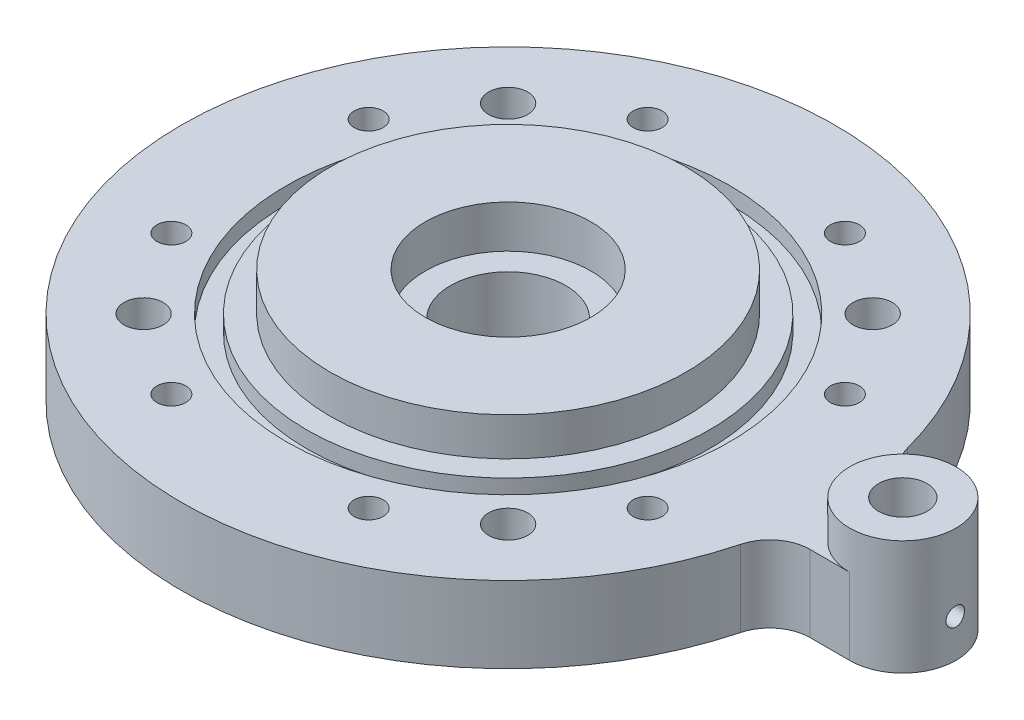
from build123d import *

# Parameters (mm, degrees)
BASE_DEPTH                       = 13.175
SKETCH3_R                        = 3.373437
SKETCH3_R_2                      = 3.373438
SQUARE_BOLT_HOLES_DEPTH          = 97.509984
SKETCH4_R                        = 2.5
HOUSING_BOLTS_DEPTH              = 44.33
CIRPATTERN1_COUNT                = 8
SKETCH2_R                        = 30.6705
SKETCH2_R_2                      = 9.167187
SKETCH2_R_3                      = 4.167187
IMPELLER_CAVITY_RISER_DEPTH      = 6.59
SKETCH5_R                        = 14.2875
SEAL_BORE_DEPTH                  = 7.35
SKETCH6_R                        = 9.9375
BORE_DEPTH                       = 39.3
PRESSURE_TAP_DEPTH               = 128.557006
PRESSURE_TAP_DEPTH_BACK          = 56.35625
SKETCH9_R                        = 1.5875
SKETCH10_R                       = 1.5875
PRESSURE_TAP_VERTICAL_HOLE_DEPTH = 8.175
SKETCH12_R                       = 38.2524
SKETCH12_R_2                     = 34.7218
CUT_EXTRUDE1_DEPTH               = 2.82448


with BuildPart() as part:
    # Sketch1 → base (new body)
    with BuildSketch(Plane(origin=(0, 0, 0), x_dir=(1, 0, 0), z_dir=(0, 1, 0))):
        with BuildLine():
            Line((61.258766, 9.167187), (68.063437, 9.167187))
            ThreePointArc((68.063437, 9.167187), (77.230625, 0), (68.063437, -9.167187))
            Line((68.063437, -9.167187), (61.258766, -9.167187))
            ThreePointArc((61.258766, -9.167187), (56.986985, -10.621749), (54.49051, -14.380934))
            ThreePointArc((54.49051, -14.380934), (-56.35625, 0), (54.49051, 14.380934))
            ThreePointArc((54.49051, 14.380934), (56.986985, 10.621749), (61.258766, 9.167187))
        make_face()
    extrude(amount=BASE_DEPTH)

    # Sketch3 → square bolt holes (cut, through all)
    with BuildSketch(Plane.XZ):
        with Locations((-31.430896, -31.430896)):
            Circle(SKETCH3_R)
        with Locations((-31.430896, 31.430896)):
            Circle(SKETCH3_R)
        with Locations((31.430896, 31.430896)):
            Circle(SKETCH3_R_2)
        with Locations((31.430896, -31.430896)):
            Circle(SKETCH3_R_2)
    extrude(amount=-SQUARE_BOLT_HOLES_DEPTH, mode=Mode.SUBTRACT)

    # Sketch4 → housing bolts (cut)
    with BuildSketch(Plane(origin=(0, 13.175, 0), x_dir=(1, 0, 0), z_dir=(0, 1, 0))):
        with Locations((17.010279, 41.066445)):
            Circle(SKETCH4_R)
    housing_bolts = extrude(amount=-HOUSING_BOLTS_DEPTH, mode=Mode.SUBTRACT)

    # CirPattern1: housing bolts ×8 about axis
    cirpattern1_axis = Axis((0, 13.175, 0), (0, 1, 0))
    for i in range(1, CIRPATTERN1_COUNT):
        add(housing_bolts.rotate(cirpattern1_axis, i * 360 / CIRPATTERN1_COUNT), mode=Mode.SUBTRACT)

    # Sketch2 → impeller cavity riser (add)
    # profile 1 of 2: a face of its own
    with BuildSketch(Plane(origin=(0, 13.175, 0), x_dir=(1, 0, 0), z_dir=(0, 1, 0))):
        Circle(SKETCH2_R)
    # profile 2 of 2: a face of its own
    with BuildSketch(Plane(origin=(0, 13.175, 0), x_dir=(1, 0, 0), z_dir=(0, 1, 0))):
        with Locations((68.063437, 0)):
            Circle(SKETCH2_R_2)
        with Locations((68.063437, 0)):
            Circle(SKETCH2_R_3, mode=Mode.SUBTRACT)
    extrude(amount=IMPELLER_CAVITY_RISER_DEPTH)

    # Sketch5 → seal bore (cut)
    with BuildSketch(Plane(origin=(0, 19.765, 0), x_dir=(1, 0, 0), z_dir=(0, 1, 0))):
        Circle(SKETCH5_R)
    extrude(amount=-SEAL_BORE_DEPTH, mode=Mode.SUBTRACT)

    # Sketch6 → bore (cut)
    with BuildSketch(Plane(origin=(0, 12.415, 0), x_dir=(1, 0, 0), z_dir=(0, 1, 0))):
        Circle(SKETCH6_R)
    extrude(amount=-BORE_DEPTH, mode=Mode.SUBTRACT)

    # Sketch9 → pressure tap (cut, two sides: drawn at the far end of the back side and taken through both)
    with BuildSketch(Plane(origin=(56.35625, 0, 0), x_dir=(0, 0, -1), z_dir=(1, 0, 0)).offset(-PRESSURE_TAP_DEPTH_BACK)):
        with Locations((0, 6.5875)):
            Circle(SKETCH9_R)
    extrude(amount=PRESSURE_TAP_DEPTH + PRESSURE_TAP_DEPTH_BACK, mode=Mode.SUBTRACT)

    # Sketch10 → pressure tap vertical hole (cut)
    with BuildSketch(Plane(origin=(0, 13.175, 0), x_dir=(1, 0, 0), z_dir=(0, 1, 0))):
        with Locations((68.063437, 0)):
            Circle(SKETCH10_R)
    extrude(amount=-PRESSURE_TAP_VERTICAL_HOLE_DEPTH, mode=Mode.SUBTRACT)

    # Sketch12 → Cut-Extrude1 (cut)
    with BuildSketch(Plane(origin=(0, 13.175, 0), x_dir=(1, 0, 0), z_dir=(0, 1, 0))):
        Circle(SKETCH12_R)
        Circle(SKETCH12_R_2, mode=Mode.SUBTRACT)
    extrude(amount=-CUT_EXTRUDE1_DEPTH, mode=Mode.SUBTRACT)


solid = part.part
